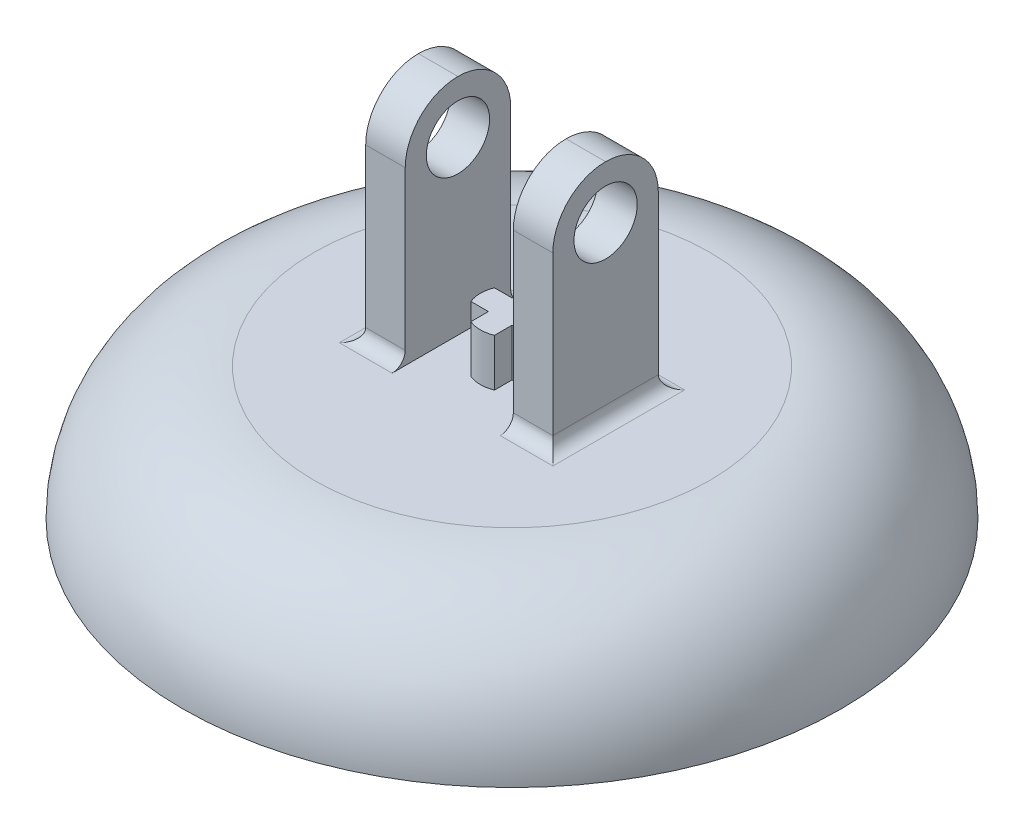
from build123d import *

# Parameters (mm, degrees)
SKETCH1_R           = 25
BOSS_EXTRUDE1_DEPTH = 10
FILLET1_R           = 10
BOSS_EXTRUDE2_DEPTH = 3.6
SKETCH3_W           = 3
SKETCH3_H           = 8
BOSS_EXTRUDE3_DEPTH = 27
SKETCH4_R           = 2.4
CUT_EXTRUDE1_DEPTH  = 49.830420846
FILLET2_R           = 4
FILLET3_R           = 1


with BuildPart() as part:
    # Sketch1 → Boss-Extrude1 (new body)
    with BuildSketch(Plane(origin=(0, 0, 0), x_dir=(1, 0, 0), z_dir=(0, 1, 0))):
        with Locations(Location((0, 0, 0), (0, 0, 270))):
            Circle(SKETCH1_R)
    extrude(amount=BOSS_EXTRUDE1_DEPTH)

    # Fillet1
    fillet1_edges = [part.edges().sort_by_distance(p)[0] for p in [
        (0, 10, -25),
    ]]
    fillet(fillet1_edges, radius=FILLET1_R - 0.0001)  # a hair under: the kernel refuses the full size

    # Sketch2 → Boss-Extrude2 (add)
    with BuildSketch(Plane(origin=(0, 10, 0), x_dir=(1, 0, 0), z_dir=(0, 1, 0))):
        with BuildLine():
            Line((-2.226875614, -0.895), (-0.895, -0.895))
            Line((-0.895, -0.895), (-0.895, -2.226875614))
            ThreePointArc((-0.895, -2.226875614), (0, -2.4), (0.895, -2.226875614))
            Line((0.895, -2.226875614), (0.895, -0.895))
            Line((0.895, -0.895), (2.226875614, -0.895))
            ThreePointArc((2.226875614, -0.895), (2.4, 0), (2.226875614, 0.895))
            Line((2.226875614, 0.895), (0.895, 0.895))
            Line((0.895, 0.895), (0.895, 2.226875614))
            ThreePointArc((0.895, 2.226875614), (0, 2.4), (-0.895, 2.226875614))
            Line((-0.895, 2.226875614), (-0.895, 0.895))
            Line((-0.895, 0.895), (-2.226875614, 0.895))
            ThreePointArc((-2.226875614, 0.895), (-2.4, 0), (-2.226875614, -0.895))
        make_face()
    extrude(amount=BOSS_EXTRUDE2_DEPTH)

    # Sketch3 → Boss-Extrude3 (add)
    with BuildSketch(Plane.XZ):
        with Locations((-5.6, 0)):
            Rectangle(SKETCH3_W, SKETCH3_H)
        with Locations((5.6, 0)):
            Rectangle(SKETCH3_W, SKETCH3_H)
    extrude(amount=-BOSS_EXTRUDE3_DEPTH)

    # Sketch4 → Cut-Extrude1 (cut, through all)
    with BuildSketch(Plane(origin=(7.1, 0, 0), x_dir=(0, 0, -1), z_dir=(1, 0, 0))):
        with Locations((0, 23)):
            Circle(SKETCH4_R)
    extrude(amount=-CUT_EXTRUDE1_DEPTH, mode=Mode.SUBTRACT)

    # Fillet2
    fillet2_edges = [part.edges().sort_by_distance(p)[0] for p in [
        (5.6, 27, -4),
        (5.6, 27, 4),
        (-5.6, 27, 4),
        (-5.6, 27, -4),
    ]]
    fillet(fillet2_edges, radius=FILLET2_R - 0.0001)  # a hair under: the kernel refuses the full size

    # Fillet3
    fillet3_edges = [part.edges().sort_by_distance(p)[0] for p in [
        (-7.1, 10, 0),
        (-5.6, 10, 4),
        (-5.6, 10, -4),
        (5.6, 10, 4),
        (7.1, 10, 0),
        (5.6, 10, -4),
    ]]
    fillet(fillet3_edges, radius=FILLET3_R)


solid = part.part
